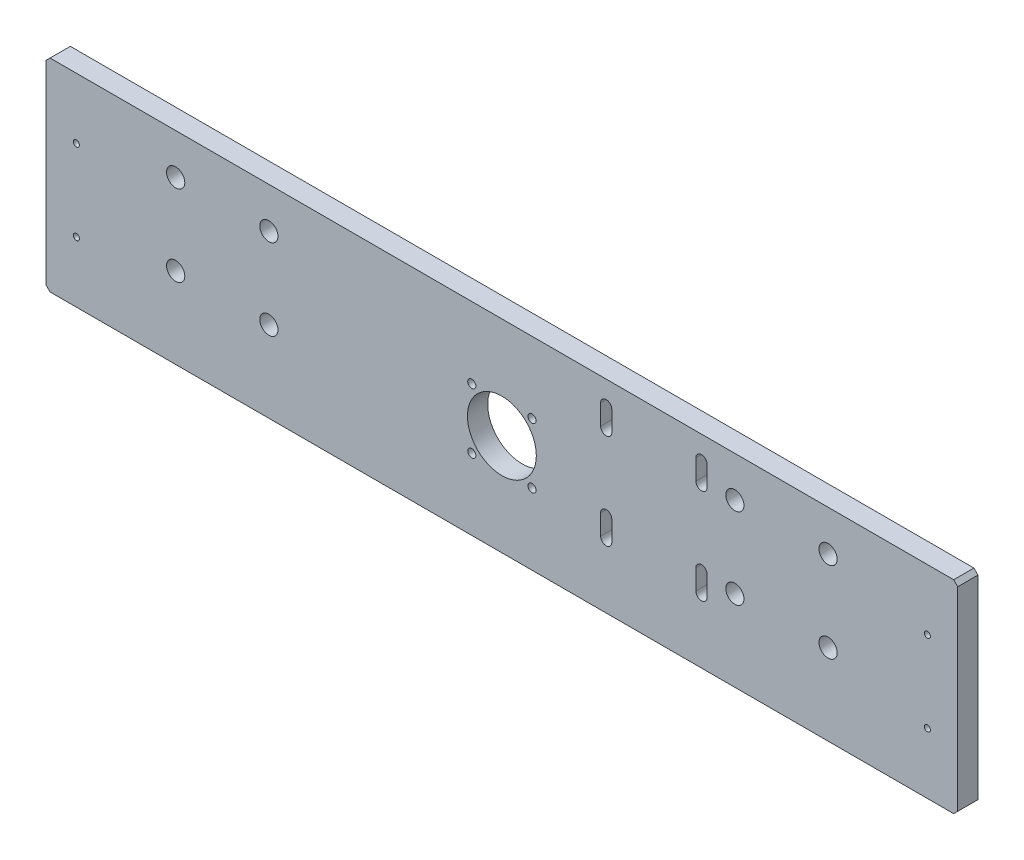
from build123d import *

# Parameters (mm, degrees)
SCHIZZO1_R          = 17
SCHIZZO1_R_2        = 2
SCHIZZO1_R_3        = 1.5
SCHIZZO1_R_4        = 4.5
BOSS_EXTRUDE1_DEPTH = 10


with BuildPart() as part:
    # Schizzo1 → Boss-Extrude1 (new body)
    with BuildSketch(Plane.XY):
        Polygon((2, 0), (448, 0), (450, 2), (450, 98), (448, 100), (2, 100), (0, 98), (0, 2), align=None)
        with Locations((225, 50)):
            Circle(SCHIZZO1_R, mode=Mode.SUBTRACT)
        with Locations((239.849242405, 64.849242405)):
            Circle(SCHIZZO1_R_2, mode=Mode.SUBTRACT)
        with Locations((239.849242405, 35.150757595)):
            Circle(SCHIZZO1_R_2, mode=Mode.SUBTRACT)
        with Locations((210.150757595, 35.150757595)):
            Circle(SCHIZZO1_R_2, mode=Mode.SUBTRACT)
        with Locations((15, 30)):
            Circle(SCHIZZO1_R_3, mode=Mode.SUBTRACT)
        with Locations((435, 30)):
            Circle(SCHIZZO1_R_3, mode=Mode.SUBTRACT)
        with Locations((210.150757595, 64.849242405)):
            Circle(SCHIZZO1_R_2, mode=Mode.SUBTRACT)
        with Locations((435, 70)):
            Circle(SCHIZZO1_R_3, mode=Mode.SUBTRACT)
        with Locations((15, 70)):
            Circle(SCHIZZO1_R_3, mode=Mode.SUBTRACT)
        with Locations((110, 80)):
            Circle(SCHIZZO1_R_4, mode=Mode.SUBTRACT)
        with Locations((110, 40)):
            Circle(SCHIZZO1_R_4, mode=Mode.SUBTRACT)
        with Locations((64, 80)):
            Circle(SCHIZZO1_R_4, mode=Mode.SUBTRACT)
        with Locations((64, 40)):
            Circle(SCHIZZO1_R_4, mode=Mode.SUBTRACT)
        with Locations((386, 40)):
            Circle(SCHIZZO1_R_4, mode=Mode.SUBTRACT)
        with Locations((340, 40)):
            Circle(SCHIZZO1_R_4, mode=Mode.SUBTRACT)
        with Locations((340, 80)):
            Circle(SCHIZZO1_R_4, mode=Mode.SUBTRACT)
        with Locations((386, 80)):
            Circle(SCHIZZO1_R_4, mode=Mode.SUBTRACT)
        with BuildLine():
            Line((320.75, 88.5), (320.75, 78.5))
            ThreePointArc((320.75, 78.5), (323.5, 75.75), (326.25, 78.5))
            Line((326.25, 78.5), (326.25, 88.5))
            ThreePointArc((326.25, 88.5), (323.5, 91.25), (320.75, 88.5))
        make_face(mode=Mode.SUBTRACT)
        with BuildLine():
            Line((279.25, 88.5), (279.25, 78.5))
            ThreePointArc((279.25, 78.5), (276.5, 75.75), (273.75, 78.5))
            Line((273.75, 78.5), (273.75, 88.5))
            ThreePointArc((273.75, 88.5), (276.5, 91.25), (279.25, 88.5))
        make_face(mode=Mode.SUBTRACT)
        with BuildLine():
            Line((320.75, 31.5), (320.75, 41.5))
            ThreePointArc((320.75, 41.5), (323.5, 44.25), (326.25, 41.5))
            Line((326.25, 41.5), (326.25, 31.5))
            ThreePointArc((326.25, 31.5), (323.5, 28.75), (320.75, 31.5))
        make_face(mode=Mode.SUBTRACT)
        with BuildLine():
            Line((279.25, 31.5), (279.25, 41.5))
            ThreePointArc((279.25, 41.5), (276.5, 44.25), (273.75, 41.5))
            Line((273.75, 41.5), (273.75, 31.5))
            ThreePointArc((273.75, 31.5), (276.5, 28.75), (279.25, 31.5))
        make_face(mode=Mode.SUBTRACT)
    extrude(amount=-BOSS_EXTRUDE1_DEPTH)


solid = part.part
